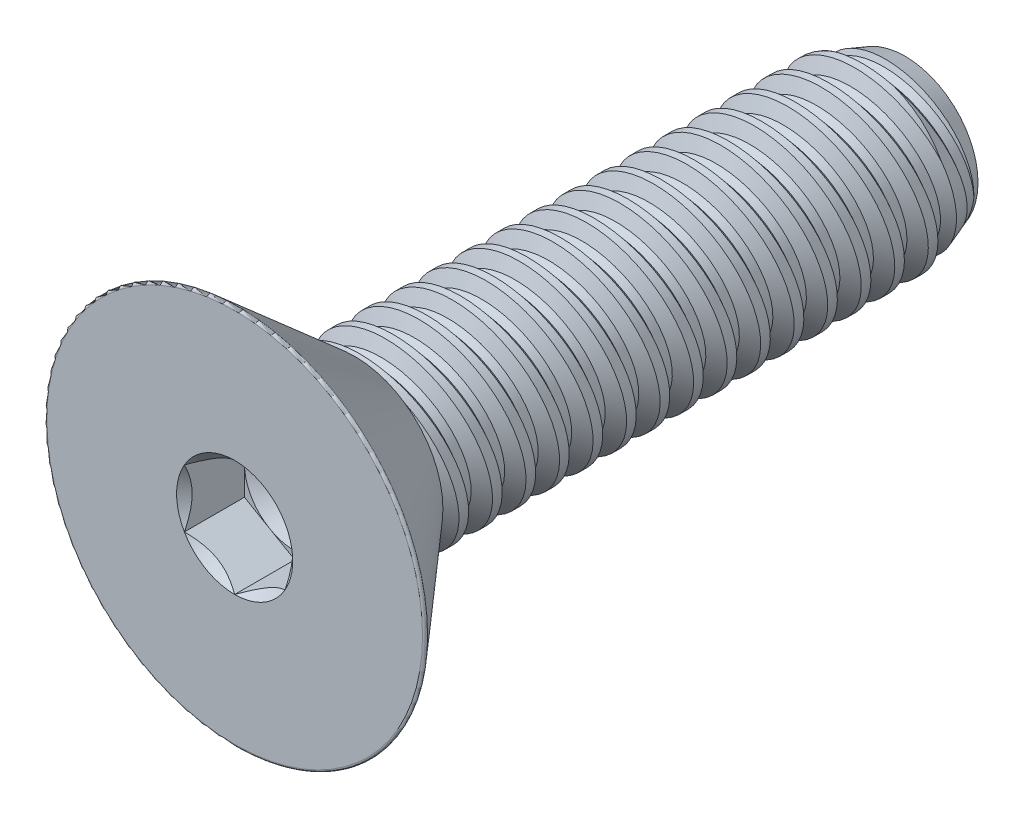
from build123d import *

# Parameters (mm, degrees)
SKETCH1_W          = 13.0302
SKETCH1_H          = 2.0828
LPATTERN1_COUNT    = 16
LPATTERN1_PITCH    = 0.79375
LPATTERN2_COUNT    = 2
LPATTERN2_PITCH    = 0.79375
SKETCH4_R          = 4.5593
EXTRUDE1_DEPTH     = 2.8448
FILLET1_R          = 0.0508
CUT_EXTRUDE1_DEPTH = 1.4224
SKETCH8_R          = 1.190625
CUT_EXTRUDE5_DEPTH = 0.474133333
CUT_EXTRUDE5_DRAFT = -60


with BuildPart() as part:
    # Sketch1 → Revolve1 (revolve)
    with BuildSketch(Plane(origin=(0, 0, 0), x_dir=(0, 0, -1), z_dir=(1, 0, 0)), mode=Mode.PRIVATE) as revolve1_sk:
        with Locations((6.5151, 1.0414)):
            Rectangle(SKETCH1_W, SKETCH1_H)
    revolve(revolve1_sk.sketch.rotate(Axis((0, 0, 0), (0, 0, 1)), 143.466023127), axis=Axis((0, 0, 0), (0, 0, 1)))

    # Sketch2 → Cut-Revolve1 (revolve, cut)
    with BuildSketch(Plane(origin=(0, 0, 0), x_dir=(0, 0, -1), z_dir=(1, 0, 0)), mode=Mode.PRIVATE) as cut_revolve1_sk:
        Polygon((0.097465104, 2.101371857), (0.779720832, 2.231374854), (0.61647657, 1.762908932), (0.421546362, 1.725765218), align=None)
    cut_revolve1 = revolve(cut_revolve1_sk.sketch.rotate(Axis((0, -0.162231854, 0), (0, 0.18718091792156116, -0.9823254572523517)), 180), axis=Axis((0, -0.162231854, 0), (0, 0.18718091792156116, -0.9823254572523517)), mode=Mode.SUBTRACT)

    # Sketch3 → Cut-Revolve2 (revolve, cut)
    with BuildSketch(Plane(origin=(0, 0, 0), x_dir=(0, 0, -1), z_dir=(1, 0, 0)), mode=Mode.PRIVATE) as cut_revolve2_sk:
        Polygon((13.0302, 1.725765218), (12.049255, 2.0828), (13.0302, 2.0828), align=None)
    revolve(cut_revolve2_sk.sketch.rotate(Axis((0, 0, -12.049255), (0, 0, 1)), 143.466023127), axis=Axis((0, 0, -12.049255), (0, 0, 1)), mode=Mode.SUBTRACT)

    # LPattern1: Cut-Revolve1 ×16
    with Locations(*[(0, 0, -i * LPATTERN1_PITCH) for i in range(1, LPATTERN1_COUNT)]):
        add(cut_revolve1, mode=Mode.SUBTRACT)

    # LPattern2: Cut-Revolve1 ×2
    with Locations(*[(0, 0, i * LPATTERN2_PITCH) for i in range(1, LPATTERN2_COUNT)]):
        add(cut_revolve1, mode=Mode.SUBTRACT)

    # Sketch4 → Extrude1 (add)
    with BuildSketch(Plane.XY):
        Circle(SKETCH4_R)
    extrude(amount=EXTRUDE1_DEPTH)

    # Sketch9 → Cut-Revolve3 (revolve, cut)
    with BuildSketch(Plane(origin=(0, 0, 0), x_dir=(0, 0, -1), z_dir=(1, 0, 0)), mode=Mode.PRIVATE) as cut_revolve3_sk:
        Polygon((-2.8448, 4.5593), (0, 2.086353088), (0, 4.5593), align=None)
    revolve(cut_revolve3_sk.sketch.rotate(Axis((0, 0, 0), (0, 0, 1)), 136.412456754), axis=Axis((0, 0, 0), (0, 0, 1)), mode=Mode.SUBTRACT)

    # Fillet1
    fillet1_edges = [part.edges().sort_by_distance(p)[0] for p in [
        (3.143464481, 3.302400271, 2.8448),
    ]]
    fillet(fillet1_edges, radius=FILLET1_R)

    # Sketch6 → Cut-Extrude1 (cut)
    with BuildSketch(Plane.XY.offset(2.8448)):
        Polygon((0, -1.374815329), (1.190625, -0.687407664), (1.190625, 0.687407664), (0, 1.374815329), (-1.190625, 0.687407664), (-1.190625, -0.687407664), align=None)
    extrude(amount=-CUT_EXTRUDE1_DEPTH, mode=Mode.SUBTRACT)

    # Cut-Extrude4 cone 1 section (through the dimple's axis) → Cut-Extrude4 (revolve, cut)
    with BuildSketch(Plane(origin=(0, 0, 2.8448), x_dir=(0, -1, 0), z_dir=(1, 0, 0))):
        Polygon((0, 0), (1.374815329, 0), (0, 1.374815329), align=None)
    revolve(axis=Axis((0, 0, 2.8448), (0, 0, -1)), mode=Mode.SUBTRACT)


with BuildPart() as cut_extrude5_tool:
    # Sketch8 → Cut-Extrude5 (with draft: the straight prism first)
    with BuildSketch(Plane.XY.offset(1.4224)):
        Circle(SKETCH8_R)
    extrude(amount=-CUT_EXTRUDE5_DEPTH)
    # Cut-Extrude5: the draft: its side faces are tilted about the plane it starts from
    cut_extrude5_sides = [cut_extrude5_tool.faces().sort_by_distance(p)[0] for p in [
        (-1.190625, 0, 1.185333333),
    ]]
    draft(cut_extrude5_sides, Plane.XY.offset(1.4224), CUT_EXTRUDE5_DRAFT)


with BuildPart() as part_1:
    add(part.part)

    # Cut-Extrude5: cut by cut_extrude5_tool
    add(cut_extrude5_tool.part, mode=Mode.SUBTRACT)


solid = part_1.part
